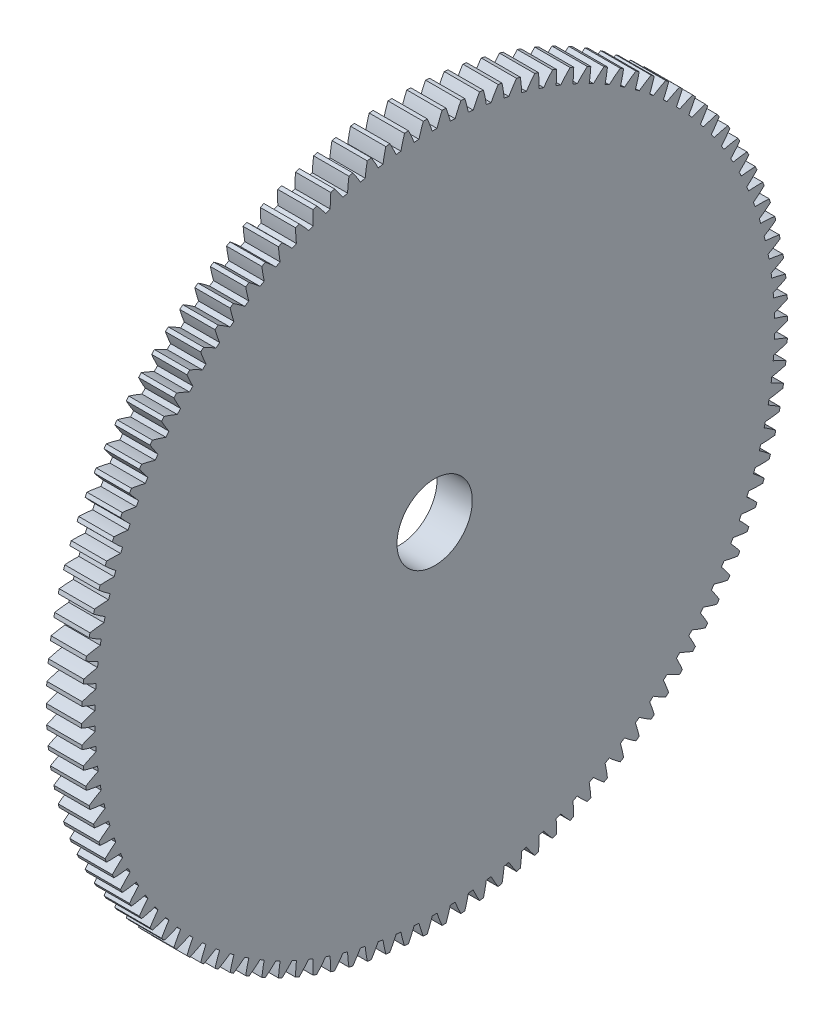
from build123d import *

# Parameters (mm, degrees)
BASPROSKE_W     = 6
BASPROSKE_H     = 60
TOOTHCUT_DEPTH  = 86.064681273
TEETHCUTS_COUNT = 118
TEETHCUTS_ANGLE = 356.949152542
BORSKE_R        = 6.4
BORE_DEPTH      = 50.0000508


with BuildPart() as part:
    # BasProSke → Base-Revolve (revolve)
    with BuildSketch(Plane(origin=(0, 0, 0), x_dir=(1, 0, 0), z_dir=(0, 1, 0))):
        with Locations((3, 30)):
            Rectangle(BASPROSKE_W, BASPROSKE_H)
    revolve(axis=Axis((-10, 0, 0), (1, 0, 0)))

    # TooCutSke → ToothCut (cut, through all)
    with BuildSketch(Plane(origin=(0, 0, 0), x_dir=(0, 0, -1), z_dir=(1, 0, 0))):
        with BuildLine():
            ThreePointArc((0.411051116, 57.747537073), (0, 57.749), (-0.411051116, 57.747537073))
            ThreePointArc((-0.411051116, 57.747537073), (-0.812414039, 58.890783051), (-1.271924304, 60.011922596))
            ThreePointArc((-1.271924304, 60.011922596), (0, 60.0254), (1.271924304, 60.011922596))
            ThreePointArc((1.271924304, 60.011922596), (0.812414039, 58.890783051), (0.411051116, 57.747537073))
        make_face()
    toothcut = extrude(amount=TOOTHCUT_DEPTH, mode=Mode.SUBTRACT)

    # TeethCuts: ToothCut ×118 about axis
    teethcuts_axis = Axis((-10, 0, 0), (1, 0, 0))
    for i in range(1, TEETHCUTS_COUNT):
        add(toothcut.rotate(teethcuts_axis, i * TEETHCUTS_ANGLE / (TEETHCUTS_COUNT - 1)), mode=Mode.SUBTRACT)

    # BorSke → Bore (cut, symmetric)
    with BuildSketch(Plane(origin=(0, 0, 0), x_dir=(0, 0, -1), z_dir=(1, 0, 0))):
        Circle(BORSKE_R)
    extrude(amount=BORE_DEPTH, both=True, mode=Mode.SUBTRACT)


solid = part.part
